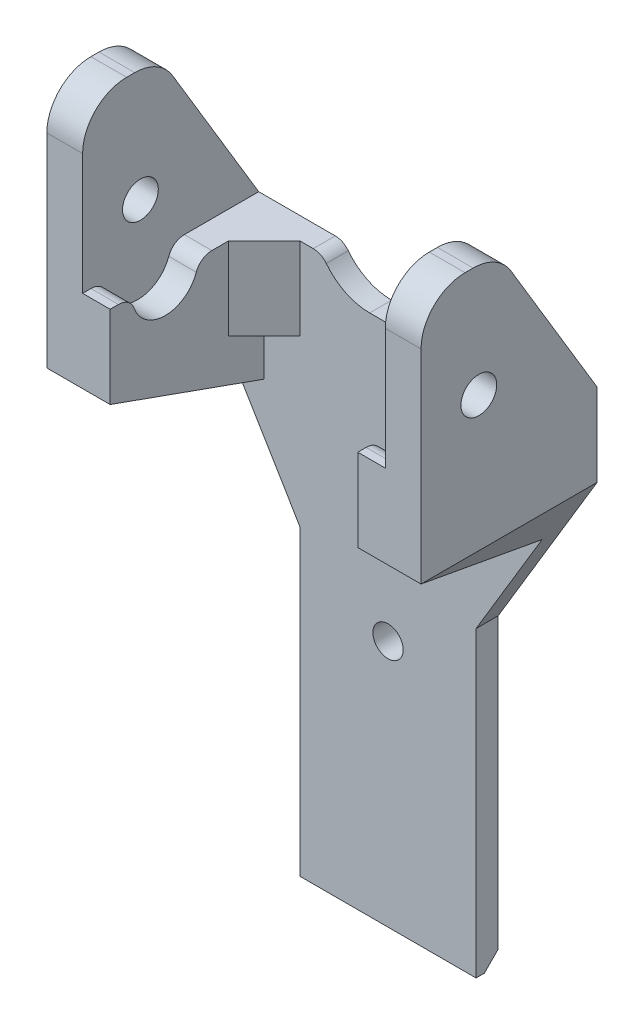
from build123d import *

# Parameters (mm, degrees)
ESQUISSE1_W                   = 32
ESQUISSE1_H                   = 100
BOSS_EXTRU_1_DEPTH            = 4
CHANFREIN1_SIZE               = 2.5
ESQUISSE2_W                   = 18
ESQUISSE2_H                   = 45
BOSS_EXTRU_2_DEPTH            = 32
ENL_V_MAT_EXTRU_1_DEPTH       = 151.159914758
ENL_V_MAT_EXTRU_1_DEPTH_BACK  = 151.159914758
ESQUISSE3_R                   = 3.25
ENL_V_MAT_EXTRU_2_DEPTH       = 143.91256068
ENL_V_MAT_EXTRU_2_DEPTH_BACK  = 143.91256068
ESQUISSE4_W                   = 55
ESQUISSE4_H                   = 32
ENL_V_MAT_EXTRU_3_DEPTH       = 117.292734081
ENL_V_MAT_EXTRU_3_DEPTH_BACK  = 117.292734081
ESQUISSE5_W                   = 45
ESQUISSE5_H                   = 23.5
CHANFREIN2_SIZE               = 6.5
ENL_V_MAT_EXTRU_4_DEPTH       = 5
ENL_V_START                   = 50
ENL_V_MAT_EXTRU_6_DEPTH       = 5
CONG_2_R                      = 3
ENL_V_MAT_EXTRU_7_DEPTH       = 151.159914758
ENL_V_MAT_EXTRU_7_DEPTH_BACK  = 151.159914758
CONG_3_R                      = 8
BOSS_EXTRU_3_DEPTH            = 4
BOSS_EXTRU_4_DEPTH            = 68
ESQUISSE10_W                  = 45
ESQUISSE10_H                  = 10
ENL_V_MAT_EXTRU_8_DEPTH       = 143.070405081
ENL_V_MAT_EXTRU_9_DEPTH       = 143.070405081
ENL_V_MAT_EXTRU_9_DEPTH_BACK  = 143.070405081
ESQUISSE11_R                  = 2.75
ENL_V_MAT_EXTRU_10_DEPTH      = 143.91256068
ENL_V_MAT_EXTRU_10_DEPTH_BACK = 143.91256068
ESQUISSE12_W                  = 24
ESQUISSE12_H                  = 5
CONG_4_R                      = 10
CONG_5_R                      = 3


# Some blends are built 0.0001 mm under size
with BuildPart() as part:
    # Esquisse1 → Boss.-Extru.1 (new body)
    with BuildSketch(Plane.XY):
        with Locations((16, 50)):
            Rectangle(ESQUISSE1_W, ESQUISSE1_H)
    extrude(amount=BOSS_EXTRU_1_DEPTH)

    # Chanfrein1
    chanfrein1_edges = [part.edges().sort_by_distance(p)[0] for p in [
        (16, 0, 0),
    ]]
    chamfer(chanfrein1_edges, length=CHANFREIN1_SIZE)

    # Esquisse2 → Boss.-Extru.2 (add)
    with BuildSketch(Plane(origin=(0, 0, 0), x_dir=(-1, 0, 0), z_dir=(0, 0, -1))):
        with Locations((-41, 107.5)):
            Rectangle(ESQUISSE2_W, ESQUISSE2_H)
        with Locations((9, 107.5)):
            Rectangle(ESQUISSE2_W, ESQUISSE2_H)
    extrude(amount=-BOSS_EXTRU_2_DEPTH)

    # Esquisse3 → Enlèv. mat.-Extru.1 (cut, two sides: drawn at the far end of the back side and taken through both)
    with BuildSketch(Plane.ZY.offset(18).offset(-ENL_V_MAT_EXTRU_1_DEPTH_BACK)):
        with Locations((21.5, 109.5)):
            Circle(ESQUISSE3_R)
    extrude(amount=ENL_V_MAT_EXTRU_1_DEPTH + ENL_V_MAT_EXTRU_1_DEPTH_BACK, mode=Mode.SUBTRACT)

    # Esquisse4 → Enlèv. mat.-Extru.2 (cut, two sides: drawn at the far end of the back side and taken through both)
    with BuildSketch(Plane.XY.offset(32).offset(-ENL_V_MAT_EXTRU_2_DEPTH_BACK)):
        with Locations((16, 116)):
            Rectangle(ESQUISSE4_W, ESQUISSE4_H)
    extrude(amount=ENL_V_MAT_EXTRU_2_DEPTH + ENL_V_MAT_EXTRU_2_DEPTH_BACK, mode=Mode.SUBTRACT)

    # Esquisse5 → Enlèv. mat.-Extru.3 (cut, two sides: drawn at the far end of the back side and taken through both)
    with BuildSketch(Plane(origin=(0, 100, 0), x_dir=(1, 0, 0), z_dir=(0, 1, 0)).offset(-ENL_V_MAT_EXTRU_3_DEPTH_BACK)):
        with Locations((16, -22.25)):
            Rectangle(ESQUISSE5_W, ESQUISSE5_H)
    extrude(amount=ENL_V_MAT_EXTRU_3_DEPTH + ENL_V_MAT_EXTRU_3_DEPTH_BACK, mode=Mode.SUBTRACT)

    # Chanfrein2
    chanfrein2_edges = [part.edges().sort_by_distance(p)[0] for p in [
        (0, 92.5, 10.5),
        (32, 92.5, 10.5),
    ]]
    chamfer(chanfrein2_edges, length=CHANFREIN2_SIZE - 0.0001)  # a hair under: the kernel refuses the full size

    # Esquisse6 → Enlèv. mat.-Extru.4 (cut)
    with BuildSketch(Plane(origin=(-6.5, 0, 0), x_dir=(0, 0, -1), z_dir=(1, 0, 0))):
        with BuildLine():
            Line((-28, 100), (-16, 100))
            ThreePointArc((-16, 100), (-22, 94), (-28, 100))
        make_face()
    extrude(amount=-ENL_V_MAT_EXTRU_4_DEPTH, mode=Mode.SUBTRACT)

    # Esquisse6<2> → Enlèv. mat.-Extru.6 (cut)
    with BuildSketch(Plane(origin=(-6.5, 0, 0), x_dir=(0, 0, -1), z_dir=(1, 0, 0)).offset(ENL_V_START)):
        with BuildLine():
            Line((-28, 100), (-16, 100))
            ThreePointArc((-16, 100), (-22, 94), (-28, 100))
        make_face()
    extrude(amount=-ENL_V_MAT_EXTRU_6_DEPTH, mode=Mode.SUBTRACT)

    # Congé2
    cong_2_edges = [part.edges().sort_by_distance(p)[0] for p in [
        (-9, 100, 16),
        (-9, 100, 28),
        (41, 100, 16),
        (41, 100, 28),
    ]]
    fillet(cong_2_edges, radius=CONG_2_R)

    # Esquisse7 → Enlèv. mat.-Extru.7 (cut, two sides: drawn at the far end of the back side and taken through both)
    with BuildSketch(Plane(origin=(50, 0, 0), x_dir=(0, 0, -1), z_dir=(1, 0, 0)).offset(-ENL_V_MAT_EXTRU_7_DEPTH_BACK)):
        Polygon((0, 100), (-18, 130), (0, 130), align=None)
    extrude(amount=ENL_V_MAT_EXTRU_7_DEPTH + ENL_V_MAT_EXTRU_7_DEPTH_BACK, mode=Mode.SUBTRACT)

    # Congé3
    cong_3_edges = [part.edges().sort_by_distance(p)[0] for p in [
        (46.75, 130, 18),
        (-14.75, 130, 18),
        (-14.75, 130, 32),
        (46.75, 130, 32),
    ]]
    fillet(cong_3_edges, radius=CONG_3_R)

    # Esquisse8 → Boss.-Extru.3 (add)
    with BuildSketch(Plane(origin=(0, 0, 0), x_dir=(-1, 0, 0), z_dir=(0, 0, -1))):
        Polygon((0, 55), (18, 85), (0, 85), align=None)
        Polygon((-32, 85), (-32, 55), (-50, 85), align=None)
    extrude(amount=-BOSS_EXTRU_3_DEPTH)

    # Esquisse9 → Boss.-Extru.4 (add)
    with BuildSketch(Plane.ZY.offset(18)):
        Polygon((32, 85), (4, 85), (4, 75), align=None)
    extrude(amount=-BOSS_EXTRU_4_DEPTH)

    # Esquisse10 → Enlèv. mat.-Extru.8 (cut, through all)
    with BuildSketch(Plane.XY.offset(4)):
        with Locations((16, 80)):
            Rectangle(ESQUISSE10_W, ESQUISSE10_H)
        Polygon((44, 75), (50, 85), (50, 75), align=None)
        Polygon((-12, 75), (-18, 85), (-18, 75), align=None)
    extrude(amount=ENL_V_MAT_EXTRU_8_DEPTH, mode=Mode.SUBTRACT)

    # Esquisse11 → Enlèv. mat.-Extru.9 (cut, two sides: drawn at the far end of the back side and taken through both)
    with BuildSketch(Plane.XY.offset(4).offset(-ENL_V_MAT_EXTRU_9_DEPTH_BACK)):
        with Locations((16, 45)):
            Circle(ESQUISSE11_R)
    extrude(amount=ENL_V_MAT_EXTRU_9_DEPTH + ENL_V_MAT_EXTRU_9_DEPTH_BACK, mode=Mode.SUBTRACT)

    # Esquisse12 → Enlèv. mat.-Extru.10 (cut, two sides: drawn at the far end of the back side and taken through both)
    with BuildSketch(Plane(origin=(0, 0, 0), x_dir=(-1, 0, 0), z_dir=(0, 0, -1)).offset(-ENL_V_MAT_EXTRU_10_DEPTH_BACK)):
        with Locations((-16, 97.5)):
            Rectangle(ESQUISSE12_W, ESQUISSE12_H)
    extrude(amount=ENL_V_MAT_EXTRU_10_DEPTH + ENL_V_MAT_EXTRU_10_DEPTH_BACK, mode=Mode.SUBTRACT)

    # Congé4
    # the kernel refuses this fillet: 10 mm, written as the material it adds along each edge
    with BuildSketch(Plane(origin=(4, 95, 0), x_dir=(0, 1, 0), z_dir=(0, 0, 1))) as cong_4_piece_1:
        with BuildLine():
            CenterArc((10, -8.660254038), CONG_4_R, 120, 60)
            Line((0, -8.660254038), (-0.2, -8.660254038))
            Line((-0.2, -8.660254038), (-0.2, 0))
            Line((-0.2, 0), (0, 0.2))
            ThreePointArc((0, 0.2), (2.5, 0.2), (4.9, 0.173205081))
            Line((4.9, 0.173205081), (5, 0))
        make_face()
    extrude(amount=4)
    with BuildSketch(Plane(origin=(28, 95, 4), x_dir=(-1, 0, 0), z_dir=(0, 0, -1))) as cong_4_piece_2:
        with BuildLine():
            CenterArc((8.660254038, 10), CONG_4_R, 210, 60)
            Line((0, 5), (-0.173205081, 4.9))
            ThreePointArc((-0.173205081, 4.9), (-0.2, 2.5), (-0.2, 0))
            Line((-0.2, 0), (0, -0.2))
            Line((0, -0.2), (8.660254038, -0.2))
            Line((8.660254038, -0.2), (8.660254038, 0))
        make_face()
    extrude(amount=4)

    # Congé5
    cong_5_edges = [part.edges().sort_by_distance(p)[0] for p in [
        (28, 100, 2),
        (4, 100, 2),
    ]]
    fillet(cong_5_edges, radius=CONG_5_R)


solid = part.part
